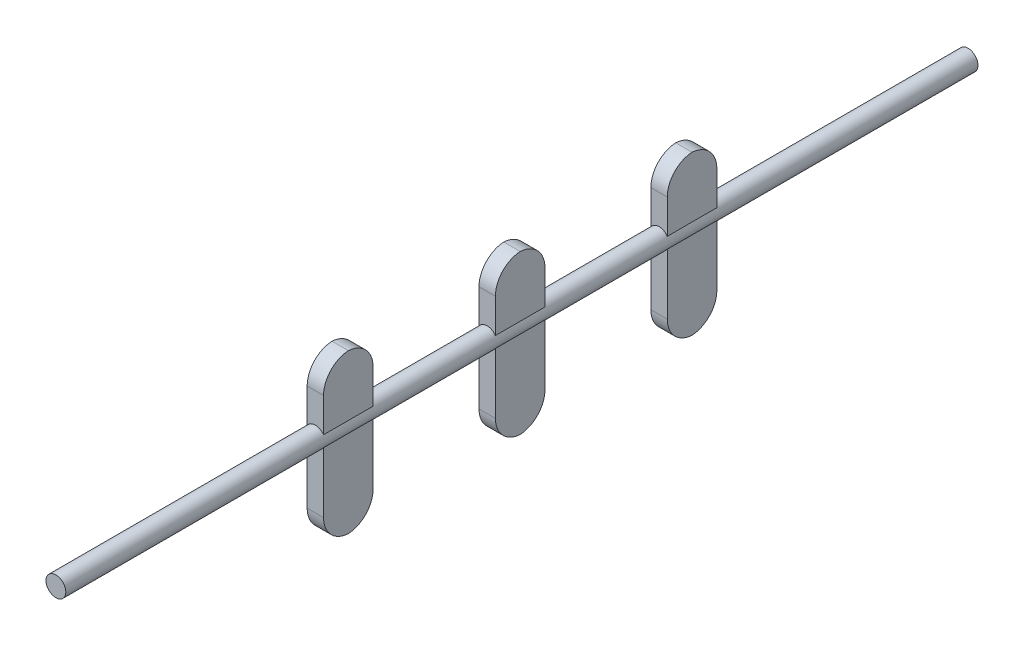
from build123d import *

# Parameters (mm, degrees)
SKETCH1_R              = 4.7625
BOSS_EXTRUDE1_DEPTH    = 438.15
SKETCH2_W              = 7.873653068
SKETCH2_H              = 76.2
BOSS_EXTRUDE2_DEPTH    = 11.90625
FILLET1_R              = 12.7
LPATTERN1_COUNT        = 2
LPATTERN1_PITCH        = 82.55
LPATTERN1_COUNT_DIR2   = 2
LPATTERN1_PITCH_DIR2   = 82.55
FILLET1_OF_LPATTERN1_R = 12.7


with BuildPart() as part:
    # Sketch1 → Boss-Extrude1 (new body)
    with BuildSketch(Plane.XY):
        Circle(SKETCH1_R)
    extrude(amount=BOSS_EXTRUDE1_DEPTH)

    # Sketch2 → Boss-Extrude2 (add, symmetric)
    with BuildSketch(Plane.XY.offset(219.075)):
        with Locations((0, -6.35)):
            Rectangle(SKETCH2_W, SKETCH2_H)
    boss_extrude2 = extrude(amount=BOSS_EXTRUDE2_DEPTH, both=True)

    # Fillet1
    # the kernel refuses this fillet: 12.7 mm, written as the material it takes off along each edge
    with BuildSketch(Plane(origin=(35.686826534, 31.75, 207.16875), x_dir=(0, -1, 0), z_dir=(-1, 0, 0)), Plane(origin=(-35.686826534, -44.45, 207.16875), x_dir=(0, 1, 0), z_dir=(1, 0, 0))) as fillet1_piece_1:
        with BuildLine():
            CenterArc((FILLET1_R, FILLET1_R), FILLET1_R, 180, 90)
            Line((0, FILLET1_R), (0, 0))
            Line((0, 0), (FILLET1_R, 0))
        make_face()
    extrude(amount=71.373653068, mode=Mode.SUBTRACT)
    with BuildSketch(Plane(origin=(35.686826534, 31.75, 230.98125), x_dir=(0, -1, 0), z_dir=(-1, 0, 0)), Plane(origin=(-35.686826534, -44.45, 230.98125), x_dir=(0, 1, 0), z_dir=(1, 0, 0))) as fillet1_piece_2:
        with BuildLine():
            CenterArc((FILLET1_R, -FILLET1_R), FILLET1_R, 90, 90)
            Line((0, -FILLET1_R), (0, 0))
            Line((0, 0), (FILLET1_R, 0))
        make_face()
    extrude(amount=71.373653068, mode=Mode.SUBTRACT)

    # LPattern1: Boss-Extrude2 2 × 2
    with Locations(*[Vector(0, 0, 1) * (i * LPATTERN1_PITCH) + Vector(0, 0, -1) * (j * LPATTERN1_PITCH_DIR2) for i in range(LPATTERN1_COUNT) for j in range(LPATTERN1_COUNT_DIR2) if (i, j) != (0, 0)]):
        add(boss_extrude2)

    # Fillet1 of LPattern1
    # the kernel refuses this fillet: 12.7 mm, written as the material it takes off along each edge
    with BuildSketch(Plane(origin=(35.686826534, 31.75, 124.61875), x_dir=(0, 0, 1), z_dir=(-1, 0, 0)), Plane(origin=(35.686826534, 31.75, 289.71875), x_dir=(0, 0, 1), z_dir=(-1, 0, 0)), Plane(origin=(35.686826534, 31.75, 313.53125), x_dir=(0, -1, 0), z_dir=(-1, 0, 0)), Plane(origin=(-35.686826534, -44.45, 289.71875), x_dir=(0, 0, 1), z_dir=(1, 0, 0)), Plane(origin=(35.686826534, 31.75, 207.16875), x_dir=(0, 0, 1), z_dir=(-1, 0, 0))) as fillet1_of_lpattern1_piece_1:
        with BuildLine():
            CenterArc((FILLET1_OF_LPATTERN1_R, -FILLET1_OF_LPATTERN1_R), FILLET1_OF_LPATTERN1_R, 90, 90)
            Line((0, -FILLET1_OF_LPATTERN1_R), (0, 0))
            Line((0, 0), (FILLET1_OF_LPATTERN1_R, 0))
        make_face()
    extrude(amount=71.373653068, mode=Mode.SUBTRACT)
    with BuildSketch(Plane(origin=(35.686826534, 31.75, 148.43125), x_dir=(0, 0, -1), z_dir=(-1, 0, 0)), Plane(origin=(-35.686826534, -44.45, 148.43125), x_dir=(0, 0, -1), z_dir=(1, 0, 0)), Plane(origin=(-35.686826534, -44.45, 124.61875), x_dir=(0, 1, 0), z_dir=(1, 0, 0)), Plane(origin=(-35.686826534, -44.45, 313.53125), x_dir=(0, 0, -1), z_dir=(1, 0, 0)), Plane(origin=(35.686826534, 31.75, 230.98125), x_dir=(0, 0, -1), z_dir=(-1, 0, 0)), Plane(origin=(-35.686826534, -44.45, 230.98125), x_dir=(0, 0, -1), z_dir=(1, 0, 0)), Plane(origin=(-35.686826534, -44.45, 207.16875), x_dir=(0, 1, 0), z_dir=(1, 0, 0))) as fillet1_of_lpattern1_piece_2:
        with BuildLine():
            CenterArc((FILLET1_OF_LPATTERN1_R, FILLET1_OF_LPATTERN1_R), FILLET1_OF_LPATTERN1_R, 180, 90)
            Line((0, FILLET1_OF_LPATTERN1_R), (0, 0))
            Line((0, 0), (FILLET1_OF_LPATTERN1_R, 0))
        make_face()
    extrude(amount=71.373653068, mode=Mode.SUBTRACT)


solid = part.part
